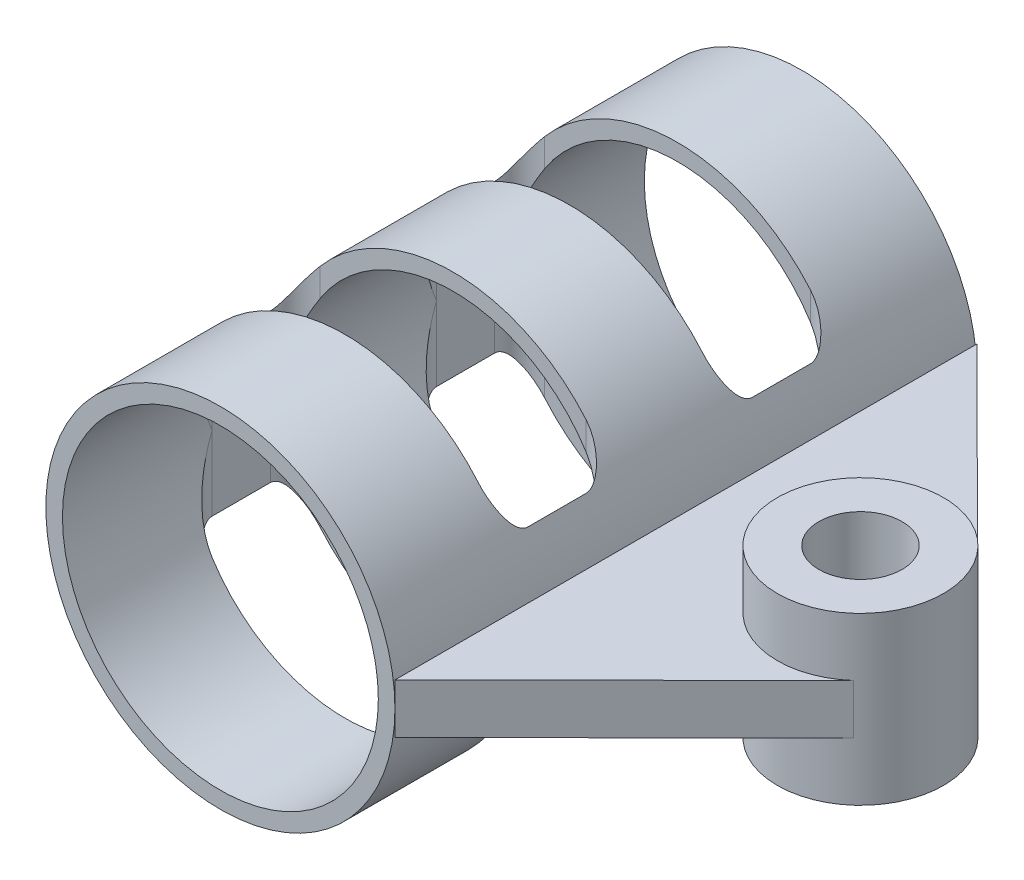
from build123d import *

# Parameters (mm, degrees)
SKETCH1_R           = 21
SKETCH1_R_2         = 19
BOSS_EXTRUDE1_DEPTH = 70
SKETCH2_R           = 10
BOSS_EXTRUDE2_DEPTH = 10
SKETCH3_R           = 5
CUT_EXTRUDE1_DEPTH  = 20
BOSS_EXTRUDE3_DEPTH = 3
CUT_EXTRUDE2_DEPTH  = 25


with BuildPart() as part:
    # Sketch1 → Boss-Extrude1 (new body)
    with BuildSketch(Plane.XY):
        Circle(SKETCH1_R)
        Circle(SKETCH1_R_2, mode=Mode.SUBTRACT)
    extrude(amount=BOSS_EXTRUDE1_DEPTH)

    # Sketch5 → Cut-Extrude2 (cut, symmetric)
    with BuildSketch(Plane(origin=(0, 0, 0), x_dir=(1, 0, 0), z_dir=(0, 1, 0))):
        with BuildLine():
            Line((-16, -15), (16, -15))
            ThreePointArc((16, -15), (18.121320344, -15.878679656), (19, -18))
            Line((19, -18), (19, -25))
            ThreePointArc((19, -25), (18.121320344, -27.121320344), (16, -28))
            Line((16, -28), (-16, -28))
            ThreePointArc((-16, -28), (-18.121320344, -27.121320344), (-19, -25))
            Line((-19, -25), (-19, -18))
            ThreePointArc((-19, -18), (-18.121320344, -15.878679656), (-16, -15))
        make_face()
        with BuildLine():
            Line((19, -52), (19, -45))
            ThreePointArc((19, -45), (18.121320344, -42.878679656), (16, -42))
            Line((16, -42), (-16, -42))
            ThreePointArc((-16, -42), (-18.121320344, -42.878679656), (-19, -45))
            Line((-19, -45), (-19, -52))
            ThreePointArc((-19, -52), (-18.121320344, -54.121320344), (-16, -55))
            Line((-16, -55), (16, -55))
            ThreePointArc((16, -55), (18.121320344, -54.121320344), (19, -52))
        make_face()
    extrude(amount=CUT_EXTRUDE2_DEPTH, both=True, mode=Mode.SUBTRACT)


with BuildPart() as body_2:
    # Sketch2 → Boss-Extrude2 (new, symmetric)
    with BuildSketch(Plane(origin=(0, 0, 0), x_dir=(1, 0, 0), z_dir=(0, 1, 0))):
        with Locations((42, -35)):
            Circle(SKETCH2_R)
    extrude(amount=BOSS_EXTRUDE2_DEPTH, both=True)

    # Sketch3 → Cut-Extrude1 (cut)
    with BuildSketch(Plane(origin=(0, 10, 0), x_dir=(1, 0, 0), z_dir=(0, 1, 0))):
        with Locations((42, -35)):
            Circle(SKETCH3_R)
    extrude(amount=-CUT_EXTRUDE1_DEPTH, mode=Mode.SUBTRACT)

    # Sketch4 → Boss-Extrude3 (add, symmetric)
    with BuildSketch(Plane(origin=(0, 0, 0), x_dir=(1, 0, 0), z_dir=(0, 1, 0))):
        with BuildLine():
            Line((21, 0), (48.634777914, -27.518040228))
            ThreePointArc((48.634777914, -27.518040228), (32, -35), (48.634777914, -42.481959772))
            Line((48.634777914, -42.481959772), (21, -70))
            Line((21, -70), (21, 0))
        make_face()
    extrude(amount=BOSS_EXTRUDE3_DEPTH, both=True)


solid = Compound([part.part, body_2.part])
